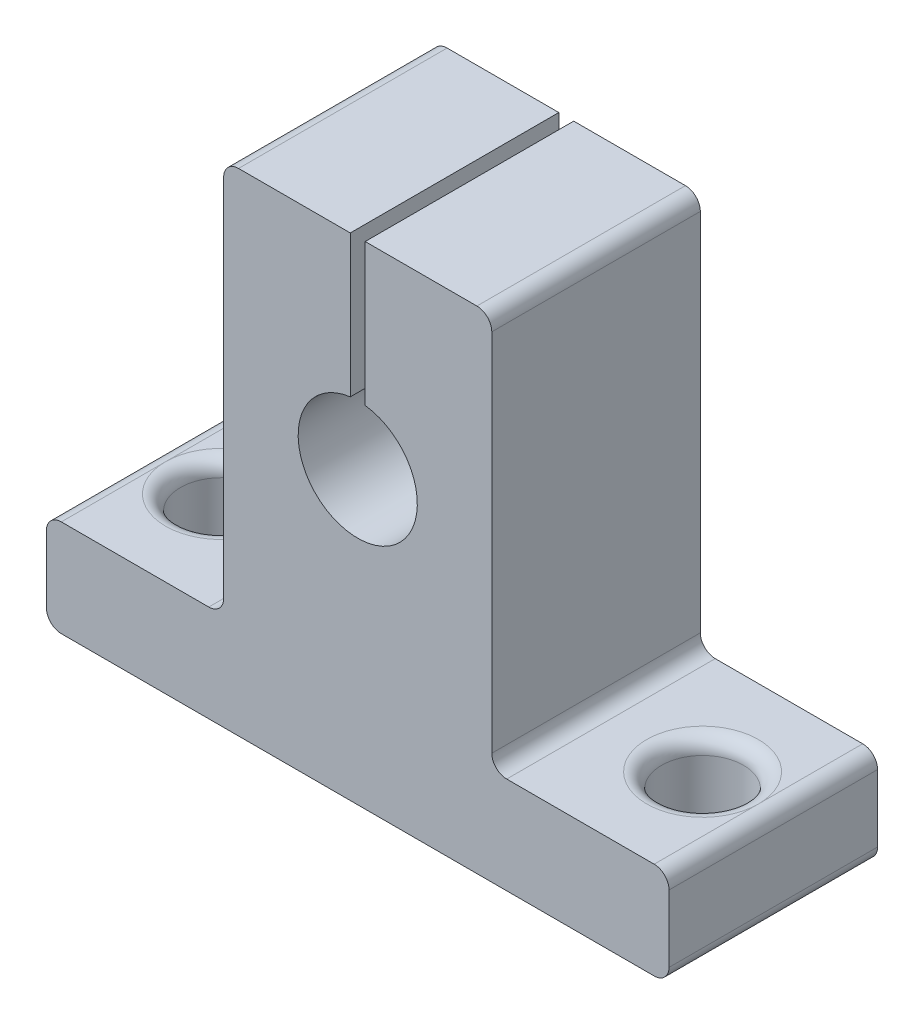
from build123d import *

# Parameters (mm, degrees)
EXTRUDE_1_DEPTH     = 14
SKETCH_2_R          = 2.75
CUT_EXTRUDE_1_DEPTH = 14
FILLET_1_R          = 1


with BuildPart() as part:
    # 草图1 → 凸台-拉伸1 (new body)
    with BuildSketch(Plane.XY):
        with BuildLine():
            Line((-0.5, 33), (-8, 33))
            ThreePointArc((-8, 33), (-8.707106781, 32.707106781), (-9, 32))
            Line((-9, 32), (-9, 7.5))
            ThreePointArc((-9, 7.5), (-9.292893219, 6.792893219), (-10, 6.5))
            Line((-10, 6.5), (-19.9, 6.5))
            ThreePointArc((-19.9, 6.5), (-20.607106781, 6.207106781), (-20.9, 5.5))
            Line((-20.9, 5.5), (-20.9, 1))
            ThreePointArc((-20.9, 1), (-20.607106781, 0.292893219), (-19.9, 0))
            Line((-19.9, 0), (19.9, 0))
            ThreePointArc((19.9, 0), (20.607106781, 0.292893219), (20.9, 1))
            Line((20.9, 1), (20.9, 5.5))
            ThreePointArc((20.9, 5.5), (20.607106781, 6.207106781), (19.9, 6.5))
            Line((19.9, 6.5), (10, 6.5))
            ThreePointArc((10, 6.5), (9.292893219, 6.792893219), (9, 7.5))
            Line((9, 7.5), (9, 32))
            ThreePointArc((9, 32), (8.707106781, 32.707106781), (8, 33))
            Line((8, 33), (0.5, 33))
            Line((0.5, 33), (0.5, 23.468626967))
            ThreePointArc((0.5, 23.468626967), (0, 15.5), (-0.5, 23.468626967))
            Line((-0.5, 23.468626967), (-0.5, 33))
        make_face()
    extrude(amount=EXTRUDE_1_DEPTH)

    # 草图2 → 切除-拉伸1 (cut)
    with BuildSketch(Plane(origin=(0, 0, 0), x_dir=(1, 0, 0), z_dir=(0, 1, 0))):
        with Locations((16.15, -7)):
            Circle(SKETCH_2_R)
        with Locations(Location((-16.15, -7, 0), (0, 0, 90))):
            Circle(SKETCH_2_R)
    extrude(amount=CUT_EXTRUDE_1_DEPTH, mode=Mode.SUBTRACT)

    # 圆角1
    fillet_1_edges = [part.edges().sort_by_distance(p)[0] for p in [
        (13.4, 0, 7),
        (13.4, 6.5, 7),
        (-16.15, 0, 9.75),
        (-16.15, 6.5, 9.75),
    ]]
    fillet(fillet_1_edges, radius=FILLET_1_R - 0.0001)  # a hair under: the kernel refuses the full size


solid = part.part
